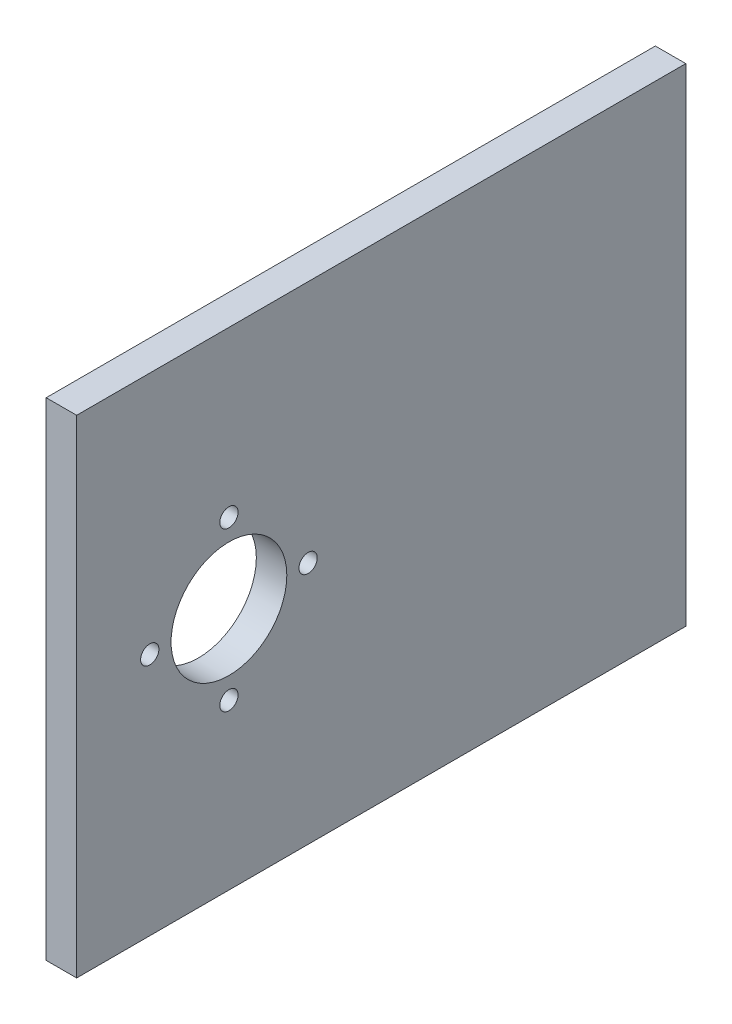
from build123d import *

# Parameters (mm, degrees)
SKETCH1_W           = 80
SKETCH1_H           = 100
SKETCH1_R           = 1.5
SKETCH1_R_2         = 9.5
BOSS_EXTRUDE1_DEPTH = 5


with BuildPart() as part:
    # Sketch1 → Boss-Extrude1 (new body)
    with BuildSketch(Plane.YZ):
        Rectangle(SKETCH1_W, SKETCH1_H)
        with Locations((0, 38)):
            Circle(SKETCH1_R, mode=Mode.SUBTRACT)
        with Locations((0, 12)):
            Circle(SKETCH1_R, mode=Mode.SUBTRACT)
        with Locations((-13, 25)):
            Circle(SKETCH1_R, mode=Mode.SUBTRACT)
        with Locations((13, 25)):
            Circle(SKETCH1_R, mode=Mode.SUBTRACT)
        with Locations((0, 25)):
            Circle(SKETCH1_R_2, mode=Mode.SUBTRACT)
    extrude(amount=BOSS_EXTRUDE1_DEPTH)


solid = part.part
